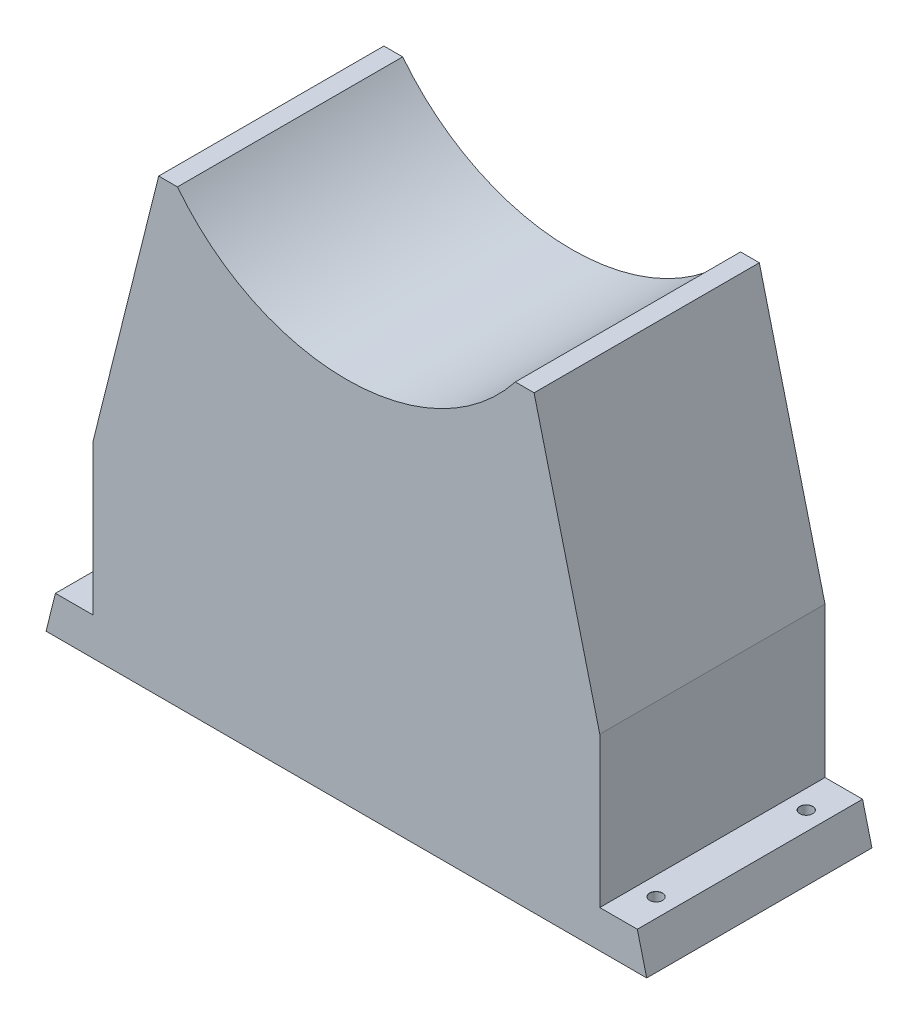
from build123d import *

# Parameters (mm, degrees)
EXTRUDE_1_DEPTH     = 60
CUT_EXTRUDE_1_REACH = 210.806
SKETCH_7_R          = 3.25
CUT_EXTRUDE_2_DEPTH = 5


# Read off the part's stored shape, not the designer's step: M3 すきま穴1
with BuildPart() as part:
    # ｽｹｯﾁ1 → ﾎﾞｽ - 押し出し1 (new body)
    with BuildSketch(Plane.XY):
        with BuildLine():
            Line((0, 0), (30, 120))
            Line((30, 120), (35, 120))
            ThreePointArc((35, 120), (80, 98.079568547), (125, 120))
            Line((125, 120), (130, 120))
            Line((130, 120), (160, 0))
            Line((160, 0), (0, 0))
        make_face()
    extrude(amount=EXTRUDE_1_DEPTH)

    # ｽｹｯﾁ2 → ｶｯﾄ - 押し出し1 (cut, up to next)
    with BuildSketch(Plane.XY.offset(60), mode=Mode.PRIVATE) as cut_extrude_1_sk1:
        Polygon((2.5, 10), (12.5, 10), (12.5, 50), align=None)
    cut_extrude_1_tool1 = extrude(cut_extrude_1_sk1.sketch, amount=-CUT_EXTRUDE_1_REACH, mode=Mode.PRIVATE) & part.part
    # ｽｹｯﾁ2 → ｶｯﾄ - 押し出し1 (cut, up to next)
    with BuildSketch(Plane.XY.offset(60), mode=Mode.PRIVATE) as cut_extrude_1_sk2:
        Polygon((157.5, 10), (147.5, 10), (147.5, 50), align=None)
    cut_extrude_1_tool2 = extrude(cut_extrude_1_sk2.sketch, amount=-CUT_EXTRUDE_1_REACH, mode=Mode.PRIVATE) & part.part
    add(cut_extrude_1_tool1.solids().sort_by_distance((9.166667, 23.333333, 60))[0], mode=Mode.SUBTRACT)
    add(cut_extrude_1_tool2.solids().sort_by_distance((150.833333, 23.333333, 60))[0], mode=Mode.SUBTRACT)

    # M3 すきま穴1 outline → M3 すきま穴1 (revolve, cut)
    with BuildSketch(Plane(origin=(152.5, 0, 50), x_dir=(1, 0, 0), z_dir=(0, 0, 1))):
        Polygon((0, 0), (1.7, 0), (1.7, 9.97124079), (1.725, 10), (0, 10), align=None)
    revolve(axis=Axis((152.5, 0, 50), (0, 1, 0)), mode=Mode.SUBTRACT)

    # Hole Wizard M3 _1 2 outline → Hole Wizard M3 _1 2 (revolve, cut)
    with BuildSketch(Plane(origin=(152.5, 0, 10), x_dir=(1, 0, 0), z_dir=(0, 0, 1))):
        Polygon((0, 0), (1.7, 0), (1.7, 9.97124079), (1.725, 10), (0, 10), align=None)
    revolve(axis=Axis((152.5, 0, 10), (0, 1, 0)), mode=Mode.SUBTRACT)

    # Hole Wizard M3 _1 3 outline → Hole Wizard M3 _1 3 (revolve, cut)
    with BuildSketch(Plane(origin=(7.5, 0, 50), x_dir=(1, 0, 0), z_dir=(0, 0, 1))):
        Polygon((0, 0), (1.7, 0), (1.7, 9.97124079), (1.725, 10), (0, 10), align=None)
    revolve(axis=Axis((7.5, 0, 50), (0, 1, 0)), mode=Mode.SUBTRACT)

    # Hole Wizard M3 _1 4 outline → Hole Wizard M3 _1 4 (revolve, cut)
    with BuildSketch(Plane(origin=(7.5, 0, 10), x_dir=(1, 0, 0), z_dir=(0, 0, 1))):
        Polygon((0, 0), (1.7, 0), (1.7, 9.97124079), (1.725, 10), (0, 10), align=None)
    revolve(axis=Axis((7.5, 0, 10), (0, 1, 0)), mode=Mode.SUBTRACT)

    # ｽｹｯﾁ7 → ｶｯﾄ - 押し出し2 (cut)
    with BuildSketch(Plane.XZ):
        with Locations((7.5, 50)):
            Circle(SKETCH_7_R)
        with Locations((7.5, 10)):
            Circle(SKETCH_7_R)
        with Locations((152.5, 10)):
            Circle(SKETCH_7_R)
        with Locations((152.5, 50)):
            Circle(SKETCH_7_R)
    extrude(amount=-CUT_EXTRUDE_2_DEPTH, mode=Mode.SUBTRACT)


solid = part.part
